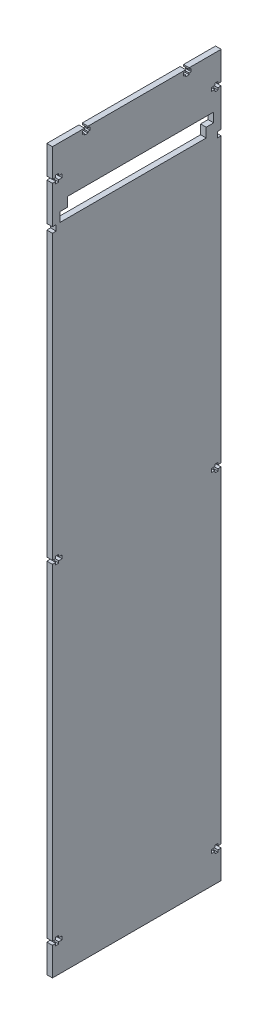
from build123d import *

# Parameters (mm, degrees)
SKETCH1_W           = 4.7625
SKETCH1_H           = 142.875
BOSS_EXTRUDE1_DEPTH = 609.6
SKETCH12_W          = 123.825
SKETCH12_H          = 7.9375
CUT_EXTRUDE7_DEPTH  = 627.13745059
SKETCH13_W          = 123.825
SKETCH13_H          = 7.9375
CUT_EXTRUDE8_DEPTH  = 627.13745059
SKETCH15_W          = 3.175
SKETCH15_H          = 4.7625
CUT_EXTRUDE10_DEPTH = 627.13745059
CUT_EXTRUDE11_DEPTH = 627.13745059
CUT_EXTRUDE12_DEPTH = 627.13745059


with BuildPart() as part:
    # Sketch1 → Boss-Extrude1 (new body)
    with BuildSketch(Plane(origin=(0, 0, 0), x_dir=(1, 0, 0), z_dir=(0, 1, 0))):
        with Locations((2.38125, 71.4375)):
            Rectangle(SKETCH1_W, SKETCH1_H)
    extrude(amount=BOSS_EXTRUDE1_DEPTH)

    # Sketch12 → Cut-Extrude7 (cut, through all)
    with BuildSketch(Plane.ZY):
        with Locations((-68.2625, 554.83125)):
            Rectangle(SKETCH12_W, SKETCH12_H)
    extrude(amount=-CUT_EXTRUDE7_DEPTH, mode=Mode.SUBTRACT)

    # Sketch13 → Cut-Extrude8 (cut, through all)
    with BuildSketch(Plane.ZY):
        with Locations((-74.6125, 562.76875)):
            Rectangle(SKETCH13_W, SKETCH13_H)
    extrude(amount=-CUT_EXTRUDE8_DEPTH, mode=Mode.SUBTRACT)

    # Sketch15 → Cut-Extrude10 (cut, through all)
    with BuildSketch(Plane.ZY):
        with Locations((-1.5875, 548.48125)):
            Rectangle(SKETCH15_W, SKETCH15_H)
        with Locations((-141.2875, 548.48125)):
            Rectangle(SKETCH15_W, SKETCH15_H)
    extrude(amount=-CUT_EXTRUDE10_DEPTH, mode=Mode.SUBTRACT)

    # Sketch16 → Cut-Extrude11 (cut, through all)
    with BuildSketch(Plane.ZY):
        Polygon((-2.794, 23.9395), (-2.794, 22.1996), (-5.334, 22.1996), (-5.334, 23.9395), (-8.128, 23.9395), (-8.128, 26.8605), (-5.334, 26.8605), (-5.334, 28.6004), (-2.794, 28.6004), (-2.794, 26.8605), (0, 26.8605), (0, 23.9395), align=None)
        Polygon((-134.747, 26.8605), (-137.541, 26.8605), (-137.541, 28.6004), (-140.081, 28.6004), (-140.081, 26.8605), (-142.875, 26.8605), (-142.875, 23.9395), (-140.081, 23.9395), (-140.081, 22.1996), (-137.541, 22.1996), (-137.541, 23.9395), (-134.747, 23.9395), align=None)
        Polygon((-134.747, 306.2605), (-137.541, 306.2605), (-137.541, 308.0004), (-140.081, 308.0004), (-140.081, 306.2605), (-142.875, 306.2605), (-142.875, 303.3395), (-140.081, 303.3395), (-140.081, 301.5996), (-137.541, 301.5996), (-137.541, 303.3395), (-134.747, 303.3395), align=None)
        Polygon((-2.794, 303.3395), (-2.794, 301.5996), (-5.334, 301.5996), (-5.334, 303.3395), (-8.128, 303.3395), (-8.128, 306.2605), (-5.334, 306.2605), (-5.334, 308.0004), (-2.794, 308.0004), (-2.794, 306.2605), (0, 306.2605), (0, 303.3395), align=None)
        Polygon((-134.747, 585.6605), (-137.541, 585.6605), (-137.541, 587.4004), (-140.081, 587.4004), (-140.081, 585.6605), (-142.875, 585.6605), (-142.875, 582.7395), (-140.081, 582.7395), (-140.081, 580.9996), (-137.541, 580.9996), (-137.541, 582.7395), (-134.747, 582.7395), align=None)
        Polygon((-2.794, 582.7395), (-2.794, 580.9996), (-5.334, 580.9996), (-5.334, 582.7395), (-8.128, 582.7395), (-8.128, 585.6605), (-5.334, 585.6605), (-5.334, 587.4004), (-2.794, 587.4004), (-2.794, 585.6605), (0, 585.6605), (0, 582.7395), align=None)
    extrude(amount=-CUT_EXTRUDE11_DEPTH, mode=Mode.SUBTRACT)

    # Sketch17 → Cut-Extrude12 (cut, through all)
    with BuildSketch(Plane.ZY):
        Polygon((-27.1145, 604.52), (-30.0355, 604.52), (-30.0355, 605.79), (-31.7754, 605.79), (-31.7754, 608.33), (-30.0355, 608.33), (-30.0355, 609.6), (-27.1145, 609.6), (-27.1145, 608.33), (-25.3746, 608.33), (-25.3746, 605.79), (-27.1145, 605.79), align=None)
        Polygon((-115.7605, 604.52), (-112.8395, 604.52), (-112.8395, 605.79), (-111.0996, 605.79), (-111.0996, 608.33), (-112.8395, 608.33), (-112.8395, 609.6), (-115.7605, 609.6), (-115.7605, 608.33), (-117.5004, 608.33), (-117.5004, 605.79), (-115.7605, 605.79), align=None)
    extrude(amount=-CUT_EXTRUDE12_DEPTH, mode=Mode.SUBTRACT)


solid = part.part
